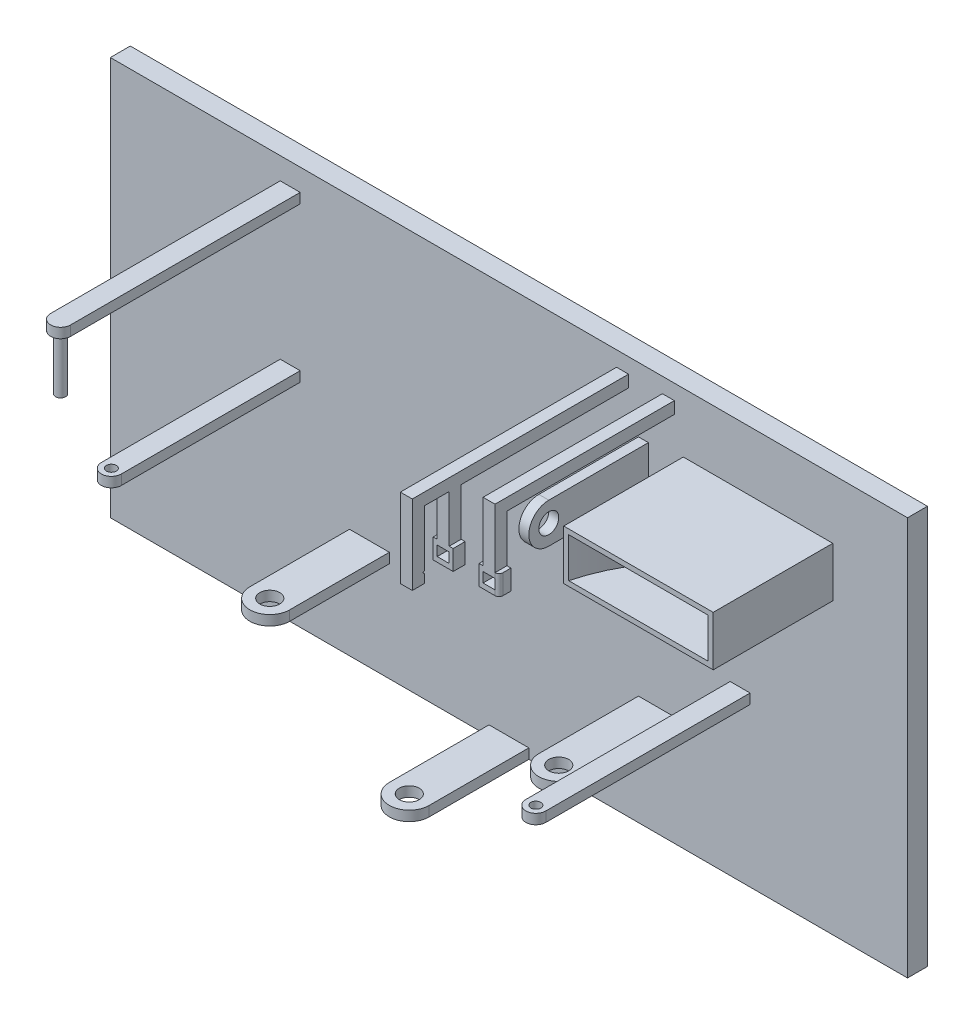
from build123d import *
from build123d.topology import SkipClean

# Parameters (mm, degrees)
SKETCH_1_W           = 800
SKETCH_1_H           = 400
EXTRUDE_1_DEPTH      = 20
SKETCH_2_W           = 40
SKETCH_2_H           = 10
EXTRUDE_2_DEPTH      = 100
SKETCH_3_R           = 20
EXTRUDE_3_DEPTH      = 10
SKETCH_4_R           = 10
CUT_EXTRUDE_1_DEPTH  = 10
SKETCH_5_W           = 40
SKETCH_5_H           = 10
EXTRUDE_4_DEPTH      = 100
SKETCH_6_R           = 20
SKETCH_6_R_2         = 10
EXTRUDE_5_DEPTH      = 10
SKETCH_8_R           = 10
CUT_EXTRUDE_2_DEPTH  = 10
SKETCH_9_W           = 10
SKETCH_9_H           = 40
EXTRUDE_6_DEPTH      = 100
SKETCH_10_R          = 20
EXTRUDE_7_DEPTH      = 10
SKETCH_11_R          = 10
CUT_EXTRUDE_3_DEPTH  = 10
SKETCH_12_W          = 40
SKETCH_12_H          = 10
EXTRUDE_8_DEPTH      = 100
SKETCH_13_R          = 20
EXTRUDE_9_DEPTH      = 10
SKETCH_14_R          = 10
CUT_EXTRUDE_4_DEPTH  = 10
SKETCH_15_W          = 20
SKETCH_15_H          = 10
EXTRUDE_10_DEPTH     = 179.5
SKETCH_16_R          = 10
EXTRUDE_11_DEPTH     = 10
SKETCH_17_R          = 4.97
CUT_EXTRUDE_5_DEPTH  = 10
SKETCH_18_W          = 12
SKETCH_18_H          = 12
EXTRUDE_12_DEPTH     = 180
SKETCH_19_W          = 12
SKETCH_19_H          = 12
EXTRUDE_13_DEPTH     = 57.52
SKETCH_20_W          = 20
SKETCH_20_H          = 20
EXTRUDE_14_DEPTH     = 12
SKETCH_21_W          = 6
SKETCH_21_H          = 5
CUT_EXTRUDE_6_DEPTH  = 12
SKETCH_23_W          = 12
SKETCH_23_H          = 12
EXTRUDE_15_DEPTH     = 180
SKETCH_24_W          = 12
SKETCH_24_H          = 12
EXTRUDE_16_DEPTH     = 67.52
EXTRUDE_17_DEPTH     = 12
SKETCH_26_W          = 6
SKETCH_26_H          = 5
CUT_EXTRUDE_7_DEPTH  = 24
SKETCH_27_W          = 12
SKETCH_27_H          = 12
EXTRUDE_18_DEPTH     = 25
SKETCH_28_W          = 12
SKETCH_28_H          = 12
EXTRUDE_19_DEPTH     = 79.52
SKETCH_29_R          = 1.1
CUT_EXTRUDE_8_DEPTH  = 25
SKETCH_30_W          = 20
SKETCH_30_H          = 10
EXTRUDE_20_DEPTH     = 205
SKETCH_31_R          = 10
EXTRUDE_21_DEPTH     = 10
SKETCH_32_R          = 5
CUT_EXTRUDE_9_DEPTH  = 10
FILLET_1_R           = 4
SKETCH_34_W          = 50
SKETCH_34_H          = 50
SKETCH_34_W_2        = 40
SKETCH_34_H_2        = 40
EXTRUDE_22_DEPTH     = 120
CUT_EXTRUDE_11_DEPTH = 123
SKETCH_36_W          = 100
SKETCH_36_H          = 50
EXTRUDE_23_DEPTH     = 44
SKETCH_38_W          = 40
SKETCH_38_H          = 40
EXTRUDE_24_DEPTH     = 120
CUT_EXTRUDE_12_DEPTH = 138
SKETCH_40_W          = 50
SKETCH_40_H          = 5
EXTRUDE_26_DEPTH     = 76
SKETCH_41_W          = 5
SKETCH_41_H          = 40
EXTRUDE_27_DEPTH     = 76
SKETCH_42_W          = 20
SKETCH_42_H          = 10
EXTRUDE_28_DEPTH     = 230.4
SKETCH_43_R          = 10
EXTRUDE_29_DEPTH     = 10
SKETCH_44_R          = 5
EXTRUDE_30_DEPTH     = 65


with BuildPart() as part:
    # 草图1 → 凸台-拉伸1 (new body)
    with BuildSketch(Plane.XY):
        Rectangle(SKETCH_1_W, SKETCH_1_H)
    extrude(amount=EXTRUDE_1_DEPTH)

    # 草图2 → 凸台-拉伸2 (add)
    with BuildSketch(Plane.XY.offset(20)):
        with Locations((0, -195)):
            Rectangle(SKETCH_2_W, SKETCH_2_H)
    extrude(amount=EXTRUDE_2_DEPTH)

    # 草图3 → 凸台-拉伸3 (add)
    with BuildSketch(Plane.XZ.offset(200)):
        with Locations((0, 120)):
            Circle(SKETCH_3_R)
    extrude(amount=-EXTRUDE_3_DEPTH)

    # 草图4 → 切除-拉伸1 (cut)
    with BuildSketch(Plane.XZ.offset(200)):
        with Locations((0, 120)):
            Circle(SKETCH_4_R)
    extrude(amount=-CUT_EXTRUDE_1_DEPTH, mode=Mode.SUBTRACT)

    # 草图5 → 凸台-拉伸4 (add)
    with BuildSketch(Plane.XY.offset(20)):
        with Locations((150, -95)):
            Rectangle(SKETCH_5_W, SKETCH_5_H)
    extrude(amount=EXTRUDE_4_DEPTH)

    # 草图6 → 凸台-拉伸5 (add)
    with BuildSketch(Plane.XZ.offset(100)):
        with Locations((150, 120)):
            Circle(SKETCH_6_R)
        with Locations((150, 120)):
            Circle(SKETCH_6_R_2, mode=Mode.SUBTRACT)
    extrude(amount=-EXTRUDE_5_DEPTH)

    # 草图8 → 切除-拉伸2 (cut)
    with BuildSketch(Plane.XZ.offset(100)):
        with Locations(Location((150, 120, 0), (0, 0, 270))):
            Circle(SKETCH_8_R)
    extrude(amount=-CUT_EXTRUDE_2_DEPTH, mode=Mode.SUBTRACT)

    # 草图9 → 凸台-拉伸6 (add)
    with BuildSketch(Plane.XY.offset(20)):
        with Locations((135, 115.3)):
            Rectangle(SKETCH_9_W, SKETCH_9_H)
    extrude(amount=EXTRUDE_6_DEPTH)

    # 草图10 → 凸台-拉伸7 (add)
    with BuildSketch(Plane(origin=(140, 0, 0), x_dir=(0, 0, -1), z_dir=(1, 0, 0))):
        with Locations((-120, 115.3)):
            Circle(SKETCH_10_R)
    extrude(amount=-EXTRUDE_7_DEPTH)

    # 草图11 → 切除-拉伸3 (cut)
    with BuildSketch(Plane(origin=(140, 0, 0), x_dir=(0, 0, -1), z_dir=(1, 0, 0))):
        with Locations((-120, 115.3)):
            Circle(SKETCH_11_R)
    extrude(amount=-CUT_EXTRUDE_3_DEPTH, mode=Mode.SUBTRACT)

    # 草图12 → 凸台-拉伸8 (add)
    with BuildSketch(Plane.XY.offset(20)):
        with Locations((-140, -95)):
            Rectangle(SKETCH_12_W, SKETCH_12_H)
    extrude(amount=EXTRUDE_8_DEPTH)

    # 草图13 → 凸台-拉伸9 (add)
    with BuildSketch(Plane.XZ.offset(100)):
        with Locations((-140, 120)):
            Circle(SKETCH_13_R)
    extrude(amount=-EXTRUDE_9_DEPTH)

    # 草图14 → 切除-拉伸4 (cut)
    with BuildSketch(Plane.XZ.offset(100)):
        with Locations(Location((-140, 120, 0), (0, 0, 270))):
            Circle(SKETCH_14_R)
    extrude(amount=-CUT_EXTRUDE_4_DEPTH, mode=Mode.SUBTRACT)

    # 草图15 → 凸台-拉伸10 (add)
    with BuildSketch(Plane.XY.offset(20)):
        with Locations((-219.5, 18.039674664)):
            Rectangle(SKETCH_15_W, SKETCH_15_H)
    extrude(amount=EXTRUDE_10_DEPTH)

    # 草图16 → 凸台-拉伸11 (add)
    with BuildSketch(Plane.XZ.offset(-13.039674664)):
        with Locations((-219.5, 199.5)):
            Circle(SKETCH_16_R)
    extrude(amount=-EXTRUDE_11_DEPTH)

    # 草图17 → 切除-拉伸5 (cut)
    with BuildSketch(Plane.XZ.offset(-13.039674664)):
        with Locations(Location((-219.5, 199.5, 0), (0, 0, 270))):
            Circle(SKETCH_17_R)
    extrude(amount=-CUT_EXTRUDE_5_DEPTH, mode=Mode.SUBTRACT)

    # 草图18 → 凸台-拉伸12 (add)
    with BuildSketch(Plane.XY.offset(20)):
        with Locations((114.03, 178.821141396)):
            Rectangle(SKETCH_18_W, SKETCH_18_H)
    extrude(amount=EXTRUDE_12_DEPTH)

    # 草图19 → 凸台-拉伸13 (add)
    with BuildSketch(Plane.XZ.offset(-172.821141396)):
        with Locations((114.03, 194)):
            Rectangle(SKETCH_19_W, SKETCH_19_H)
    extrude(amount=EXTRUDE_13_DEPTH)

    # 草图20 → 凸台-拉伸14 (add)
    with BuildSketch(Plane.XY.offset(200)):
        with Locations((114.03, 115.301141396)):
            Rectangle(SKETCH_20_W, SKETCH_20_H)
    extrude(amount=-EXTRUDE_14_DEPTH)

    # 草图21 → 切除-拉伸6 (cut)
    with BuildSketch(Plane.XY.offset(200)):
        with Locations((111.03, 112.801141396)):
            Rectangle(SKETCH_21_W, SKETCH_21_H)
        Polygon((114.03, 115.301141396), (120.03, 115.301141396), (120.03, 120.301141396), (108.03, 120.301141396), (108.03, 115.301141396), align=None)
        with Locations((117.03, 112.801141396)):
            Rectangle(SKETCH_21_W, SKETCH_21_H)
    extrude(amount=-CUT_EXTRUDE_6_DEPTH, mode=Mode.SUBTRACT)

    # 草图23 → 凸台-拉伸15 (add)
    with BuildSketch(Plane.XY.offset(20)):
        with Locations((160.03, 178.821141396)):
            Rectangle(SKETCH_23_W, SKETCH_23_H)
    extrude(amount=EXTRUDE_15_DEPTH)

    # 草图24 → 凸台-拉伸16 (add)
    with BuildSketch(Plane.XZ.offset(-172.821141396)):
        with Locations((160.03, 194)):
            Rectangle(SKETCH_24_W, SKETCH_24_H)
    extrude(amount=EXTRUDE_16_DEPTH)

    # 草图25 → 凸台-拉伸17 (add)
    with BuildSketch(Plane.XY.offset(200)):
        Polygon((160.03, 105.301141396), (150.03, 105.301141396), (150.03, 125.301141396), (170.03, 125.301141396), (170.03, 105.301141396), align=None)
    extrude(amount=-EXTRUDE_17_DEPTH)

    # 草图26 → 切除-拉伸7 (cut)
    with BuildSketch(Plane.XY.offset(200)):
        Polygon((160.03, 115.301141396), (166.03, 115.301141396), (166.03, 120.301141396), (154.03, 120.301141396), (154.03, 115.301141396), align=None)
        with Locations((157.03, 112.801141396)):
            Rectangle(SKETCH_26_W, SKETCH_26_H)
        with Locations((163.03, 112.801141396)):
            Rectangle(SKETCH_26_W, SKETCH_26_H)
    extrude(amount=-CUT_EXTRUDE_7_DEPTH, mode=Mode.SUBTRACT)

    # 草图27 → 凸台-拉伸18 (add)
    with BuildSketch(Plane.XY.offset(200)):
        with Locations((114.03, 178.821141396)):
            Rectangle(SKETCH_27_W, SKETCH_27_H)
    extrude(amount=EXTRUDE_18_DEPTH)

    # 草图28 → 凸台-拉伸19 (add)
    with BuildSketch(Plane(origin=(0, 184.821141396, 0), x_dir=(1, 0, 0), z_dir=(0, 1, 0))):
        with Locations((114.03, -231)):
            Rectangle(SKETCH_28_W, SKETCH_28_H)
    extrude(amount=-EXTRUDE_19_DEPTH)

    # 草图29 → 切除-拉伸8 (cut)
    with BuildSketch(Plane.ZY.offset(-108.03)):
        with Locations((225, 115.301141396)):
            Circle(SKETCH_29_R)
    extrude(amount=-CUT_EXTRUDE_8_DEPTH, mode=Mode.SUBTRACT)

    # 草图30 → 凸台-拉伸20 (add)
    with BuildSketch(Plane.XY.offset(20)):
        with Locations((232.03, -36.293292708)):
            Rectangle(SKETCH_30_W, SKETCH_30_H)
    extrude(amount=EXTRUDE_20_DEPTH)

    # 草图31 → 凸台-拉伸21 (add)
    with BuildSketch(Plane.XZ.offset(41.293292708)):
        with Locations((232.03, 225)):
            Circle(SKETCH_31_R)
    extrude(amount=-EXTRUDE_21_DEPTH)

    # 草图32 → 切除-拉伸9 (cut)
    with BuildSketch(Plane.XZ.offset(41.293292708)):
        with Locations(Location((232.03, 225, 0), (0, 0, 270))):
            Circle(SKETCH_32_R)
    extrude(amount=-CUT_EXTRUDE_9_DEPTH, mode=Mode.SUBTRACT)

    # 圆角1
    fillet_1_edges = [part.edges().sort_by_distance(p)[0] for p in [
        (170.03, 115.301141396, 200),
    ]]
    fillet(fillet_1_edges, radius=FILLET_1_R - 0.0001)  # a hair under: the kernel refuses the full size

    # 草图34 → 凸台-拉伸22 (add)
    with BuildSketch(Plane.XY.offset(20)):
        with Locations((200, 115.3)):
            Rectangle(SKETCH_34_W, SKETCH_34_H)
        with Locations((200, 115.3)):
            Rectangle(SKETCH_34_W_2, SKETCH_34_H_2, mode=Mode.SUBTRACT)
    extrude(amount=EXTRUDE_22_DEPTH)

    # 草图35 → 切除-拉伸11 (cut)
    with BuildSketch(Plane.XZ.offset(-90.3)):
        with BuildLine():
            ThreePointArc((225, 63.606100651), (397.8155791, 33.031914681), (494.282032303, 179.641016151))
            ThreePointArc((494.282032303, 179.641016151), (314.663465241, 338.027099812), (180, 140))
            Line((180, 140), (225, 140))
            Line((225, 140), (225, 63.606100651))
        make_face()
        with BuildLine():
            Line((225, 140), (180, 140))
            ThreePointArc((180, 140), (197.090097892, 98.616335196), (225, 63.606100651))
            Line((225, 63.606100651), (225, 140))
        make_face()
    extrude(amount=-CUT_EXTRUDE_11_DEPTH, mode=Mode.SUBTRACT)

    # 草图36 → 凸台-拉伸23 (add)
    with BuildSketch(Plane.XY.offset(20)):
        with Locations((275, 115.3)):
            Rectangle(SKETCH_36_W, SKETCH_36_H)
    extrude(amount=EXTRUDE_23_DEPTH)

    # 草图38 → 凸台-拉伸24 (add)
    with BuildSketch(Plane.XY.offset(20)):
        with Locations((200, 115.3)):
            Rectangle(SKETCH_38_W, SKETCH_38_H)
    extrude(amount=EXTRUDE_24_DEPTH)

    # 草图39 → 切除-拉伸12 (cut)
    with SkipClean():  # the faces are left unmerged after this step: merging them gives an invalid solid
        with BuildSketch(Plane.XZ.offset(-95.3)):
            with BuildLine():
                Line((220, 140), (220, 68.543349868))
                ThreePointArc((220, 68.543349868), (195.340203367, 101.66321421), (180, 140))
                Line((180, 140), (220, 140))
            make_face()
        extrude(amount=-CUT_EXTRUDE_12_DEPTH, mode=Mode.SUBTRACT)

    # 草图40 → 凸台-拉伸26 (add)
    with SkipClean():  # the faces are left unmerged after this step: merging them gives an invalid solid
        with BuildSketch(Plane.XY.offset(64)):
            Polygon((325, 135.3), (325, 140.3), (320, 140.3), (225, 140.3), (225, 135.3), align=None)
            Polygon((325, 90.3), (325, 95.3), (225, 95.3), (225, 90.3), (320, 90.3), align=None)
            with Locations((200, 92.8)):
                Rectangle(SKETCH_40_W, SKETCH_40_H)
            with Locations((200, 137.8)):
                Rectangle(SKETCH_40_W, SKETCH_40_H)
        extrude(amount=EXTRUDE_26_DEPTH)

    # 草图41 → 凸台-拉伸27 (add)
    with SkipClean():  # the faces are left unmerged after this step: merging them gives an invalid solid
        with BuildSketch(Plane.XY.offset(64)):
            with Locations((322.5, 115.3)):
                Rectangle(SKETCH_41_W, SKETCH_41_H)
        extrude(amount=EXTRUDE_27_DEPTH)

    # 草图42 → 凸台-拉伸28 (add)
    with SkipClean():  # the faces are left unmerged after this step: merging them gives an invalid solid
        with BuildSketch(Plane.XY.offset(20)):
            with Locations((-219.5, 173.039674664)):
                Rectangle(SKETCH_42_W, SKETCH_42_H)
        extrude(amount=EXTRUDE_28_DEPTH)

    # 草图43 → 凸台-拉伸29 (add)
    with SkipClean():  # the faces are left unmerged after this step: merging them gives an invalid solid
        with BuildSketch(Plane(origin=(0, 178.039674664, 0), x_dir=(1, 0, 0), z_dir=(0, 1, 0))):
            with Locations((-219.5, -250.4)):
                Circle(SKETCH_43_R)
        extrude(amount=-EXTRUDE_29_DEPTH)

    # 草图44 → 凸台-拉伸30 (add)
    with SkipClean():  # the faces are left unmerged after this step: merging them gives an invalid solid
        with BuildSketch(Plane(origin=(0, 178.039674664, 0), x_dir=(1, 0, 0), z_dir=(0, 1, 0))):
            with Locations(Location((-219.5, -250.4, 0), (0, 0, 180))):
                Circle(SKETCH_44_R)
        extrude(amount=-EXTRUDE_30_DEPTH)


solid = part.part
